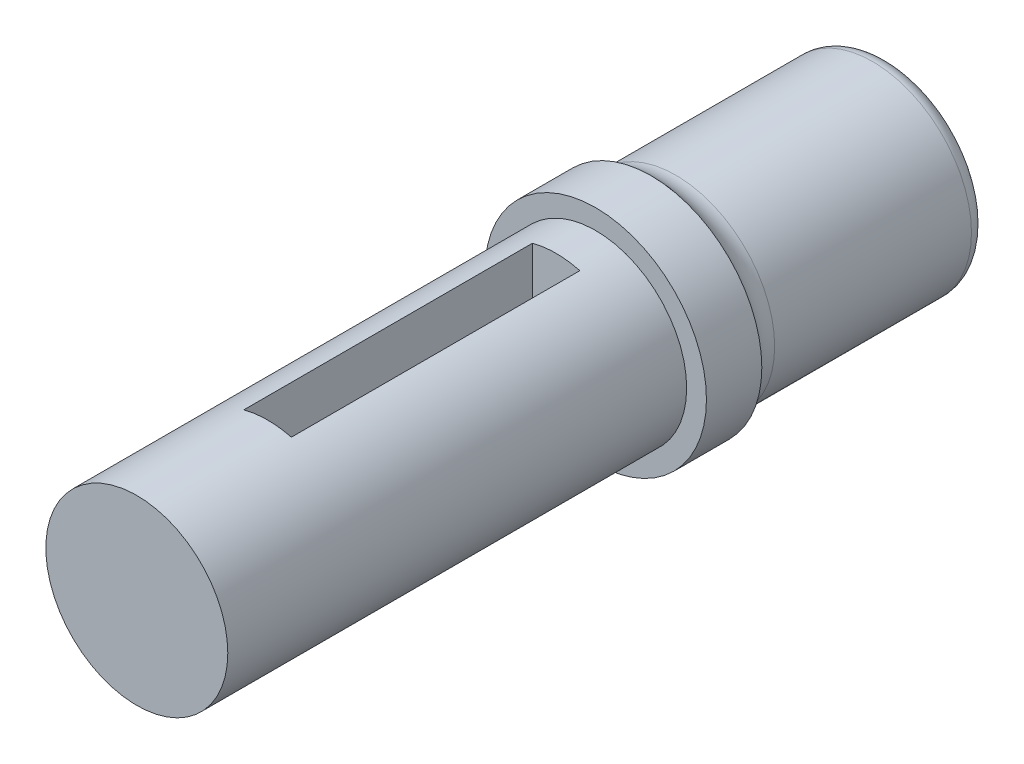
from build123d import *

# Parameters (mm, degrees)
SKETCH1_R               = 70
BOSS_EXTRUDE1_DEPTH     = 35
SKETCH2_R               = 62.5
BOSS_EXTRUDE2_DEPTH     = 150
FILLET1_R               = 20
SKETCH3_R               = 57.5
BOSS_EXTRUDE3_DEPTH     = 325
CUT_EXTRUDE1_DEPTH      = 15
CUT_EXTRUDE1_DEPTH_BACK = 15
FILLET2_R               = 10


with BuildPart() as part:
    # Sketch1 → Boss-Extrude1 (new body)
    with BuildSketch(Plane.XY):
        Circle(SKETCH1_R)
    extrude(amount=BOSS_EXTRUDE1_DEPTH)

    # Sketch2 → Boss-Extrude2 (add)
    with BuildSketch(Plane.XY):
        Circle(SKETCH2_R)
    extrude(amount=-BOSS_EXTRUDE2_DEPTH)

    # Fillet1
    # the kernel refuses this fillet: 20 mm, written as the material it adds along each edge
    with BuildSketch(Plane(origin=(0, 0, 0), x_dir=(1, 0, 0), z_dir=(0, -1, 0))) as fillet1_piece_1:
        with BuildLine():
            CenterArc((82.5, -15.612494996), FILLET1_R, 128.682187453, 51.317812547)
            Line((62.5, -15.612494996), (62.1, -15.612494996))
            Line((62.1, -15.612494996), (62.1, 0))
            Line((62.1, 0), (62.5, 0.4))
            ThreePointArc((62.5, 0.4), (66.25, 0.4), (69.75, 0.3122499))
            Line((69.75, 0.3122499), (70, 0))
        make_face()
    revolve(axis=Axis((0, 0, 0), (0, 0, 1)))

    # Sketch3 → Boss-Extrude3 (add)
    with BuildSketch(Plane.XY):
        Circle(SKETCH3_R)
    extrude(amount=BOSS_EXTRUDE3_DEPTH)

    # Sketch4 → Cut-Extrude1 (cut, two sides: drawn at the far end of the back side and taken through both)
    with BuildSketch(Plane(origin=(0, 0, 0), x_dir=(0, 0, -1), z_dir=(1, 0, 0)).offset(-CUT_EXTRUDE1_DEPTH_BACK)):
        Polygon((-240, 0), (-251.375, 273), (-60, 273), (-60, 0), (-60, -273), (-228.625, -273), align=None)
    extrude(amount=CUT_EXTRUDE1_DEPTH + CUT_EXTRUDE1_DEPTH_BACK, mode=Mode.SUBTRACT)

    # Fillet2
    fillet2_edges = [part.edges().sort_by_distance(p)[0] for p in [
        (-62.5, 0, -150),
    ]]
    fillet(fillet2_edges, radius=FILLET2_R)


solid = part.part
